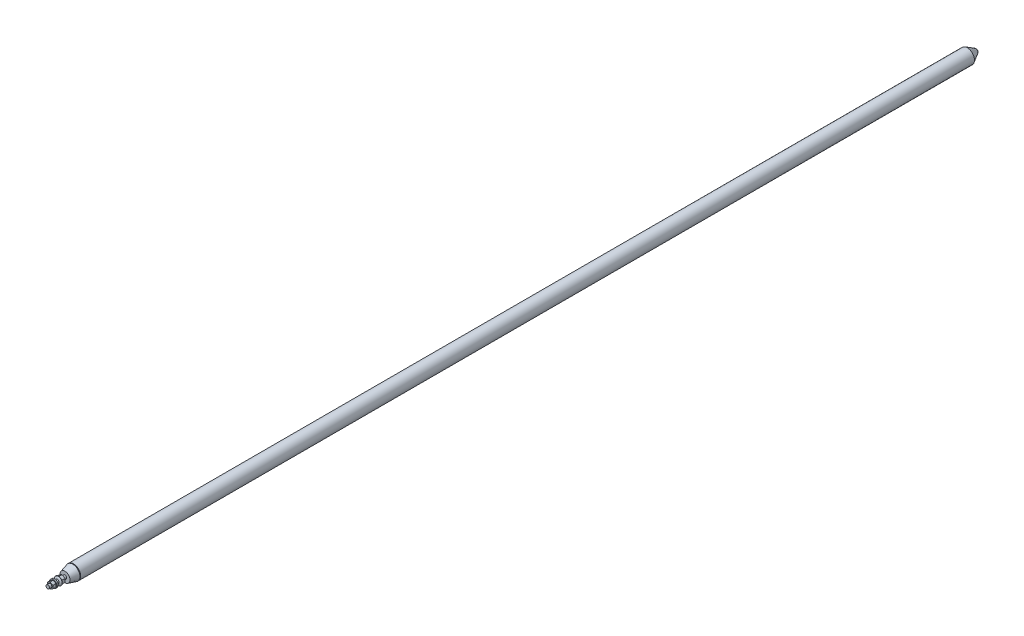
from build123d import *

# Parameters (mm, degrees)
BOSS_REVOLVE3_START         = 12.690475
BOSS_REVOLVE3_OUTLINE_R     = 7.9375
BOSS_REVOLVE3_DEPTH         = 15.478125
BOSS_REVOLVE3_START_2       = 46.292398399
BOSS_REVOLVE3_2_OUTLINE_R   = 16.6751
BOSS_REVOLVE3_2_OUTLINE_R_2 = 7.9375
BOSS_REVOLVE3_2_DEPTH       = 5.8166
BOSS_EXTRUDE2_DEPTH         = 13.890625


# Read off the part's stored shape, not the designer's step: Boss-Revolve3
with BuildPart() as part:
    # Sketch1 → Base-Revolve (revolve)
    with BuildSketch(Plane(origin=(0, 0, 0), x_dir=(0, 0, -1), z_dir=(1, 0, 0)), mode=Mode.PRIVATE) as base_revolve_sk:
        Polygon((-76.2, 0), (-76.2, 7.9375), (0, 7.9375), (0, 22.225), (34.895210283, 31.75), (38.1, 28.575), (47.625, 28.575), (47.625, 0), align=None)
    revolve(base_revolve_sk.sketch.rotate(Axis((0, 0, 0), (0, 0, 1)), 90), axis=Axis((0, 0, 0), (0, 0, 1)))

    # Sketch3 → Boss-Revolve2 (revolve)
    with BuildSketch(Plane(origin=(0, 0, 0), x_dir=(0, 0, -1), z_dir=(1, 0, 0)), mode=Mode.PRIVATE) as boss_revolve2_sk:
        with BuildLine():
            Line((-28.1686, 0), (-28.1686, 17.4625))
            Line((-28.1686, 17.4625), (-29.7688, 17.4625))
            ThreePointArc((-29.7688, 17.4625), (-33.309963658, 9.048473715), (-34.5186, 0))
            Line((-34.5186, 0), (-28.1686, 0))
        make_face()
    revolve(boss_revolve2_sk.sketch.rotate(Axis((0, 0, 0), (0, 0, 1)), 90), axis=Axis((0, 0, 0), (0, 0, 1)))

    # Sketch2 → Boss-Revolve1 (revolve)
    with BuildSketch(Plane(origin=(0, 0, 0), x_dir=(0, 0, -1), z_dir=(1, 0, 0)), mode=Mode.PRIVATE) as boss_revolve1_sk:
        with BuildLine():
            Line((38.1, 31.75), (38.1, 28.5623))
            Line((38.1, 28.5623), (4008.394586153, 28.5623))
            Line((4008.394586153, 28.5623), (4008.394586153, 0))
            Line((4008.394586153, 0), (4050.687199293, 0))
            ThreePointArc((4050.687199293, 0), (4048.985721921, 6.35), (4044.337199293, 10.998522628))
            Line((4044.337199293, 10.998522628), (4008.394586153, 31.75))
            Line((4008.394586153, 31.75), (38.1, 31.75))
        make_face()
    revolve(boss_revolve1_sk.sketch.rotate(Axis((0, 0, 29.7434), (0, 0, -1)), 90), axis=Axis((0, 0, 29.7434), (0, 0, -1)))

    # Boss-Revolve3 outline → Boss-Revolve3 (add)
    with BuildSketch(Plane.XY.offset(BOSS_REVOLVE3_START)):
        Polygon((0, -15.588572738), (13.5001, -7.794286369), (13.5001, 7.794286369), (0, 15.588572738), (-13.5001, 7.794286369), (-13.5001, -7.794286369), align=None)
        Circle(BOSS_REVOLVE3_OUTLINE_R, mode=Mode.SUBTRACT)
    extrude(amount=BOSS_REVOLVE3_DEPTH)

    # Boss-Revolve3 2 outline → Boss-Revolve3 2 (add)
    with BuildSketch(Plane.XY.offset(BOSS_REVOLVE3_START_2)):
        Circle(BOSS_REVOLVE3_2_OUTLINE_R)
        Circle(BOSS_REVOLVE3_2_OUTLINE_R_2, mode=Mode.SUBTRACT)
    extrude(amount=BOSS_REVOLVE3_2_DEPTH)

    # Sketch6 → Boss-Extrude2 (add)
    with BuildSketch(Plane.XY.offset(52.108998399)):
        Polygon((0, -13.755485633), (11.9126, -6.877742817), (11.9126, 6.877742817), (0, 13.755485633), (-11.9126, 6.877742817), (-11.9126, -6.877742817), align=None)
    extrude(amount=BOSS_EXTRUDE2_DEPTH)


solid = part.part
